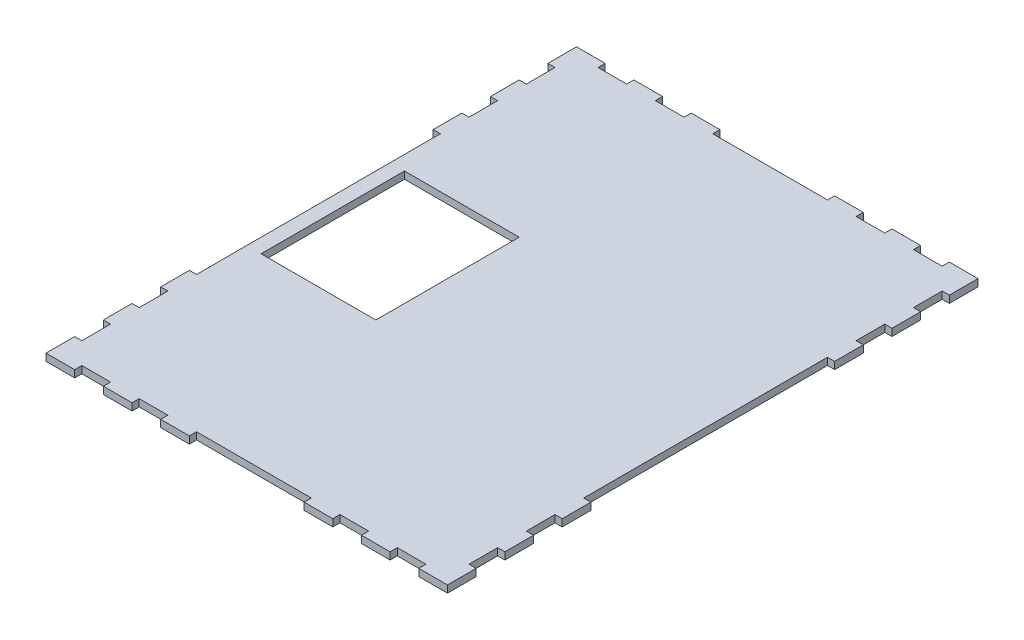
from build123d import *

# Parameters (mm, degrees)
BOSS_EXTRUDE1_DEPTH = 3.175
SKETCH5_W           = 50.8
SKETCH5_H           = 3.175
SKETCH5_W_2         = 12.7
CUT_EXTRUDE4_DEPTH  = 7.62
SKETCH7_W           = 50.8
SKETCH7_H           = 63.5
CUT_EXTRUDE5_DEPTH  = 7.62


with BuildPart() as part:
    # Sketch1 → Boss-Extrude1 (new body)
    with BuildSketch(Plane(origin=(0, 0, 0), x_dir=(1, 0, 0), z_dir=(0, 1, 0))):
        Polygon((3.175, 209.55), (0, 209.55), (0, 196.85), (3.175, 196.85), (3.175, 184.15), (0, 184.15), (0, 171.45), (3.175, 171.45), (3.175, 63.5), (0, 63.5), (0, 50.8), (3.175, 50.8), (3.175, 38.1), (0, 38.1), (0, 25.4), (3.175, 25.4), (3.175, 12.7), (0, 12.7), (0, 0), (177.8, 0), (177.8, 12.7), (174.625, 12.7), (174.625, 25.4), (177.8, 25.4), (177.8, 38.1), (174.625, 38.1), (174.625, 50.8), (177.8, 50.8), (177.8, 63.5), (174.625, 63.5), (174.625, 171.45), (177.8, 171.45), (177.8, 184.15), (174.625, 184.15), (174.625, 196.85), (177.8, 196.85), (177.8, 209.55), (174.625, 209.55), (174.625, 222.25), (177.8, 222.25), (177.8, 234.95), (0, 234.95), (0, 222.25), (3.175, 222.25), align=None)
    extrude(amount=BOSS_EXTRUDE1_DEPTH)

    # Sketch5 → Cut-Extrude4 (cut)
    with BuildSketch(Plane(origin=(0, 3.175, 0), x_dir=(1, 0, 0), z_dir=(0, 1, 0))):
        with Locations((88.9, 1.5875)):
            Rectangle(SKETCH5_W, SKETCH5_H)
        with Locations((44.45, 1.5875)):
            Rectangle(SKETCH5_W_2, SKETCH5_H)
        with Locations((133.35, 1.5875)):
            Rectangle(SKETCH5_W_2, SKETCH5_H)
        with Locations((19.05, 1.5875)):
            Rectangle(SKETCH5_W_2, SKETCH5_H)
        with Locations((158.75, 1.5875)):
            Rectangle(SKETCH5_W_2, SKETCH5_H)
    cut_extrude4 = extrude(amount=-CUT_EXTRUDE4_DEPTH, mode=Mode.SUBTRACT)

    # Mirror1: Cut-Extrude4 across plane
    add(cut_extrude4.mirror(Plane.XY.offset(-117.475)), mode=Mode.SUBTRACT)

    # Sketch7 → Cut-Extrude5 (cut)
    with BuildSketch(Plane(origin=(0, 3.175, 0), x_dir=(1, 0, 0), z_dir=(0, 1, 0))):
        with Locations((34.925, 117.475)):
            Rectangle(SKETCH7_W, SKETCH7_H)
    extrude(amount=-CUT_EXTRUDE5_DEPTH, mode=Mode.SUBTRACT)


solid = part.part
